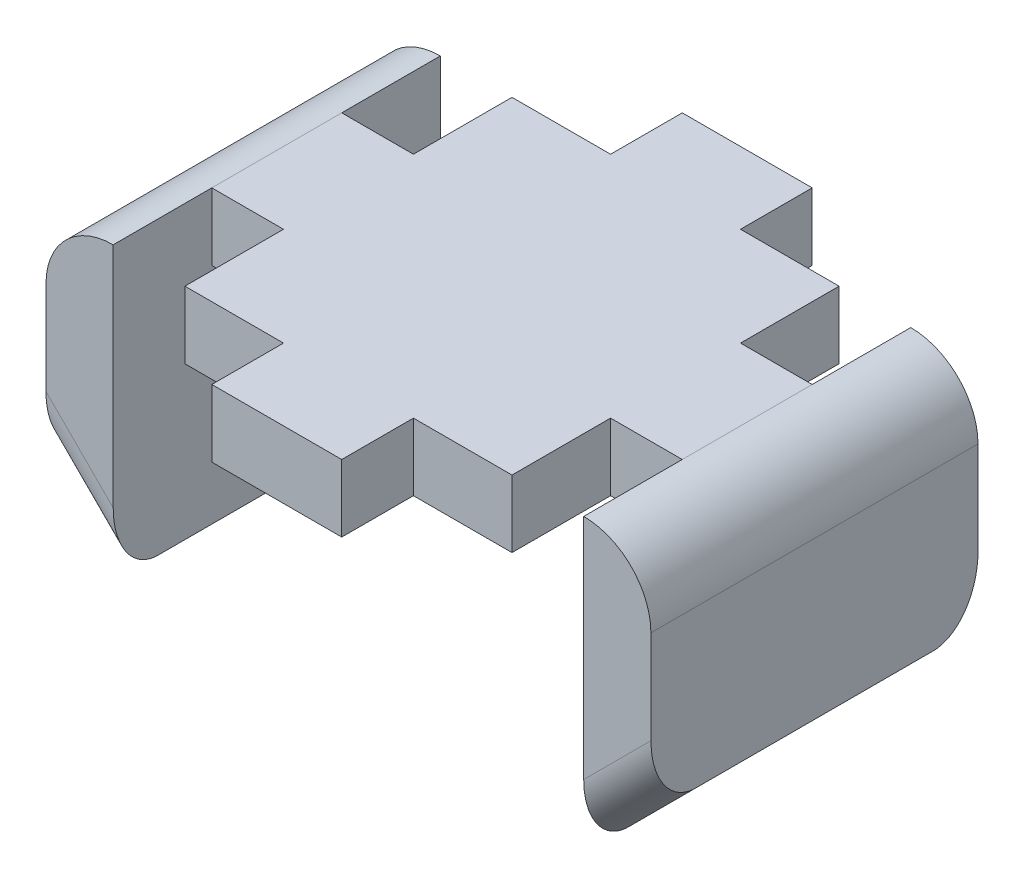
from build123d import *

# Parameters (mm, degrees)
SKETCH1_W           = 14.6
SKETCH1_H           = 14.6
BOSS_EXTRUDE1_DEPTH = 1.5
SKETCH2_W           = 5.8
SKETCH2_H           = 3.2
SKETCH2_W_2         = 3.2
SKETCH2_H_2         = 5.8
BOSS_EXTRUDE2_DEPTH = 1.5
SKETCH4_W           = 14.6
SKETCH4_H           = 13
BOSS_EXTRUDE3_DEPTH = 3
FILLET5_R           = 3
CHAMFER1_SIZE       = 3
FILLET4_R           = 2


with BuildPart() as part:
    # Sketch1 → Boss-Extrude1 (new, symmetric)
    with BuildSketch(Plane(origin=(0, 0, 0), x_dir=(1, 0, 0), z_dir=(0, 1, 0))):
        Rectangle(SKETCH1_W, SKETCH1_H)
    extrude(amount=BOSS_EXTRUDE1_DEPTH, both=True)

    # Sketch2 → Boss-Extrude2 (add, symmetric)
    with BuildSketch(Plane(origin=(0, 0, 0), x_dir=(1, 0, 0), z_dir=(0, 1, 0))):
        with Locations((0, 8.9)):
            Rectangle(SKETCH2_W, SKETCH2_H)
        with Locations((0, -8.9)):
            Rectangle(SKETCH2_W, SKETCH2_H)
        with Locations((-8.9, 0)):
            Rectangle(SKETCH2_W_2, SKETCH2_H_2)
        with Locations((8.9, 0)):
            Rectangle(SKETCH2_W_2, SKETCH2_H_2)
    extrude(amount=BOSS_EXTRUDE2_DEPTH, both=True)

    # Sketch4 → Boss-Extrude3 (add)
    with BuildSketch(Plane.ZY.offset(10.5)):
        with Locations((0, -5)):
            Rectangle(SKETCH4_W, SKETCH4_H)
    boss_extrude3 = extrude(amount=BOSS_EXTRUDE3_DEPTH)

    # Mirror1: Boss-Extrude3 across plane
    add(boss_extrude3.mirror(Plane(origin=(0, 0, 0), x_dir=(0, 0, 1), z_dir=(1, 0, 0))))

    # Fillet5
    fillet5_edges = [part.edges().sort_by_distance(p)[0] for p in [
        (-13.5, 1.5, 0),
        (13.5, 1.5, 0),
    ]]
    fillet(fillet5_edges, radius=FILLET5_R)

    # Chamfer1
    chamfer1_edges = [part.edges().sort_by_distance(p)[0] for p in [
        (13.5, -11.5, 0),
        (-13.5, -11.5, 0),
    ]]
    chamfer(chamfer1_edges, length=CHAMFER1_SIZE - 0.0001)  # a hair under: the kernel refuses the full size

    # Fillet4
    fillet4_edges = [part.edges().sort_by_distance(p)[0] for p in [
        (-12.00005, -10.00005, 7.3),
        (-12.00005, -10.00005, -7.3),
        (12.00005, -10.00005, 7.3),
        (12.00005, -10.00005, -7.3),
    ]]
    fillet(fillet4_edges, radius=FILLET4_R)


solid = part.part
